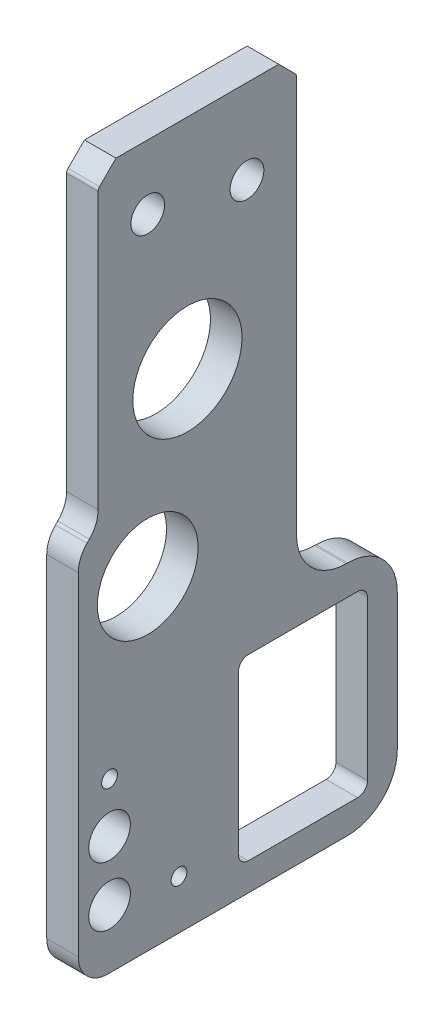
from build123d import *

# Parameters (mm, degrees)
SKETCH1_R           = 5.075
SKETCH1_R_2         = 1.7
SKETCH1_R_3         = 2.1
SKETCH1_R_4         = 0.8
SKETCH1_W           = 13
SKETCH1_H           = 18
BOSS_EXTRUDE1_DEPTH = 3.18
SKETCH3_R           = 5.5
CUT_EXTRUDE4_DEPTH  = 78.831812262
FILLET2_R           = 3
CHAMFER2_SIZE       = 1.8
FILLET4_R           = 0.5
M2_TAPPED_HOLE1_D   = 1.6
FILLET9_R           = 1
FILLET11_R          = 5


with BuildPart() as part:
    # Sketch1 → Boss-Extrude1 (new body)
    with BuildSketch(Plane(origin=(0, 0, 0), x_dir=(0, 0, -1), z_dir=(1, 0, 0))):
        Polygon((0, 0), (0, 37.775), (2, 39.775), (2, 70.81), (22, 70.81), (22, 23.81), (32.15, 23.81), (32.15, 0), align=None)
        with Locations((7, 32.7)):
            Circle(SKETCH1_R, mode=Mode.SUBTRACT)
        with Locations((7, 64.31)):
            Circle(SKETCH1_R_2, mode=Mode.SUBTRACT)
        with Locations((17, 62.31)):
            Circle(SKETCH1_R_2, mode=Mode.SUBTRACT)
        with Locations((3.15, 5.95)):
            Circle(SKETCH1_R_3, mode=Mode.SUBTRACT)
        with Locations((3.15, 11.95)):
            Circle(SKETCH1_R_3, mode=Mode.SUBTRACT)
        with Locations((10.15, 4.95)):
            Circle(SKETCH1_R_4, mode=Mode.SUBTRACT)
        with Locations((3.15, 16.95)):
            Circle(SKETCH1_R_4, mode=Mode.SUBTRACT)
        with Locations((22.65, 11.81)):
            Rectangle(SKETCH1_W, SKETCH1_H, mode=Mode.SUBTRACT)
    extrude(amount=BOSS_EXTRUDE1_DEPTH)

    # Sketch3 → Cut-Extrude4 (cut, through all)
    with BuildSketch(Plane.ZY):
        with Locations((-11, 48.810865899)):
            Circle(SKETCH3_R)
    extrude(amount=-CUT_EXTRUDE4_DEPTH, mode=Mode.SUBTRACT)

    # Fillet2
    fillet2_edges = [part.edges().sort_by_distance(p)[0] for p in [
        (1.59, 37.775, 0),
        (1.59, 39.775, -2),
        (1.59, 0, 0),
    ]]
    fillet(fillet2_edges, radius=FILLET2_R)

    # Chamfer2
    chamfer2_edges = [part.edges().sort_by_distance(p)[0] for p in [
        (1.59, 70.81, -22),
        (1.59, 70.81, -2),
    ]]
    chamfer(chamfer2_edges, length=CHAMFER2_SIZE)

    # Fillet4
    fillet4_edges = [part.edges().sort_by_distance(p)[0] for p in [
        (1.59, 69.01, -2),
        (1.59, 69.01, -22),
    ]]
    fillet(fillet4_edges, radius=FILLET4_R)

    # M2 Tapped Hole1 (through all)
    with Locations(Plane(origin=(0, 16.95, -3.15), x_dir=(0, 0, -1), z_dir=(-1, 0, 0))):
        with Locations((0, 0), (7, 12)):
            Hole(M2_TAPPED_HOLE1_D / 2)

    # Fillet9
    fillet9_edges = [part.edges().sort_by_distance(p)[0] for p in [
        (1.59, 2.81, -29.15),
        (1.59, 2.81, -16.15),
        (1.59, 20.81, -29.15),
        (1.59, 20.81, -16.15),
    ]]
    fillet(fillet9_edges, radius=FILLET9_R)

    # Fillet11
    fillet11_edges = [part.edges().sort_by_distance(p)[0] for p in [
        (1.59, 0, -32.15),
        (1.59, 23.81, -22),
        (1.59, 23.81, -32.15),
    ]]
    fillet(fillet11_edges, radius=FILLET11_R)


solid = part.part
